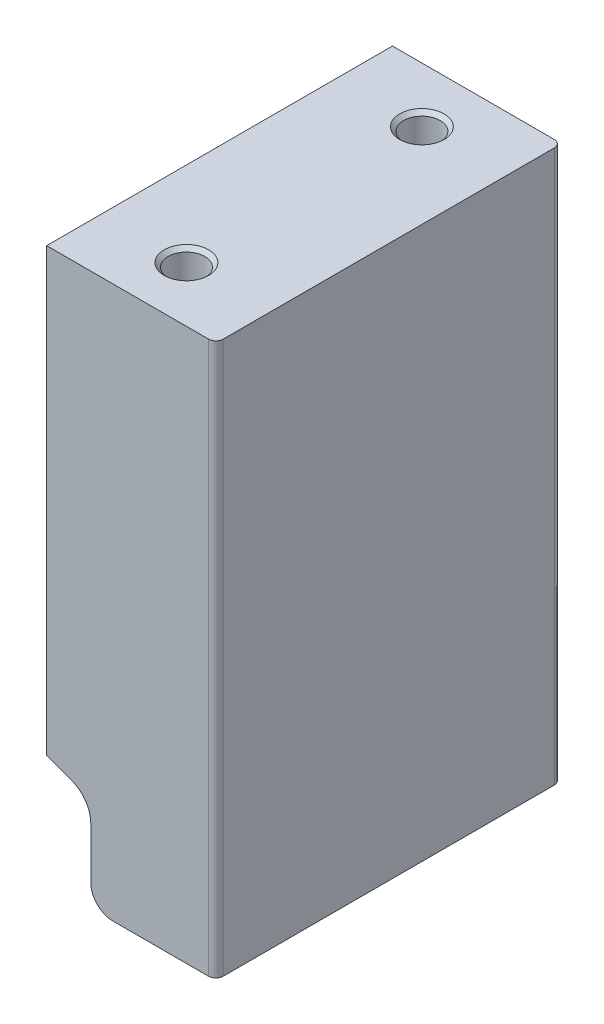
from build123d import *

# Parameters (mm, degrees)
SKETCH1_W                   = 23
SKETCH1_H                   = 47
BOSS_EXTRUDE1_DEPTH         = 75
CUT_EXTRUDE1_REACH          = 91.254
FILLET1_R                   = 3
FILLET2_R                   = 1
M6_TAPPED_HOLE1_D           = 5
M6_TAPPED_HOLE1_DEPTH       = 17
M6_TAPPED_HOLE1_CSINK_D     = 6.05
M6_TAPPED_HOLE1_CSINK_ANGLE = 90
M6_TAPPED_HOLE1_TIP         = 1.502151548


with BuildPart() as part:
    # Sketch1 → Boss-Extrude1 (new body)
    with BuildSketch(Plane(origin=(0, 0, 0), x_dir=(1, 0, 0), z_dir=(0, 1, 0))):
        Rectangle(SKETCH1_W, SKETCH1_H)
    extrude(amount=-BOSS_EXTRUDE1_DEPTH)

    # Sketch2 → Cut-Extrude1 (cut, up to next)
    with BuildSketch(Plane.XY.offset(23.5), mode=Mode.PRIVATE) as cut_extrude1_sk1:
        with BuildLine():
            Line((-8.131919427, -61.241229517), (-11.5, -60.015348442))
            Line((-11.5, -60.015348442), (-11.5, -75))
            Line((-11.5, -75), (-5.5, -75))
            Line((-5.5, -75), (-5.5, -65))
            ThreePointArc((-5.5, -65), (-6.223391823, -62.705694255), (-8.131919427, -61.241229517))
        make_face()
    cut_extrude1_tool1 = extrude(cut_extrude1_sk1.sketch, amount=-CUT_EXTRUDE1_REACH, mode=Mode.PRIVATE) & part.part
    add(cut_extrude1_tool1.solids().sort_by_distance((-8.622504, -68.134359, 23.5))[0], mode=Mode.SUBTRACT)

    # Fillet1
    fillet1_edges = [part.edges().sort_by_distance(p)[0] for p in [
        (-5.5, -75, 0),
    ]]
    fillet(fillet1_edges, radius=FILLET1_R)

    # Fillet2
    fillet2_edges = [part.edges().sort_by_distance(p)[0] for p in [
        (11.5, -37.5, -23.5),
        (11.5, -37.5, 23.5),
    ]]
    fillet(fillet2_edges, radius=FILLET2_R)

    # M6 Tapped Hole1
    with Locations(Plane(origin=(0, 0, 0), x_dir=(1, 0, 0), z_dir=(0, 1, 0))):
        with Locations((0, 16), (0, -16)):
            CounterSinkHole(M6_TAPPED_HOLE1_D / 2, M6_TAPPED_HOLE1_CSINK_D / 2, depth=M6_TAPPED_HOLE1_DEPTH, counter_sink_angle=M6_TAPPED_HOLE1_CSINK_ANGLE)
            with Locations((0, 0, -(M6_TAPPED_HOLE1_DEPTH + M6_TAPPED_HOLE1_TIP / 2))):  # 118° drill point
                Cone(0, M6_TAPPED_HOLE1_D / 2, M6_TAPPED_HOLE1_TIP, mode=Mode.SUBTRACT)


solid = part.part
